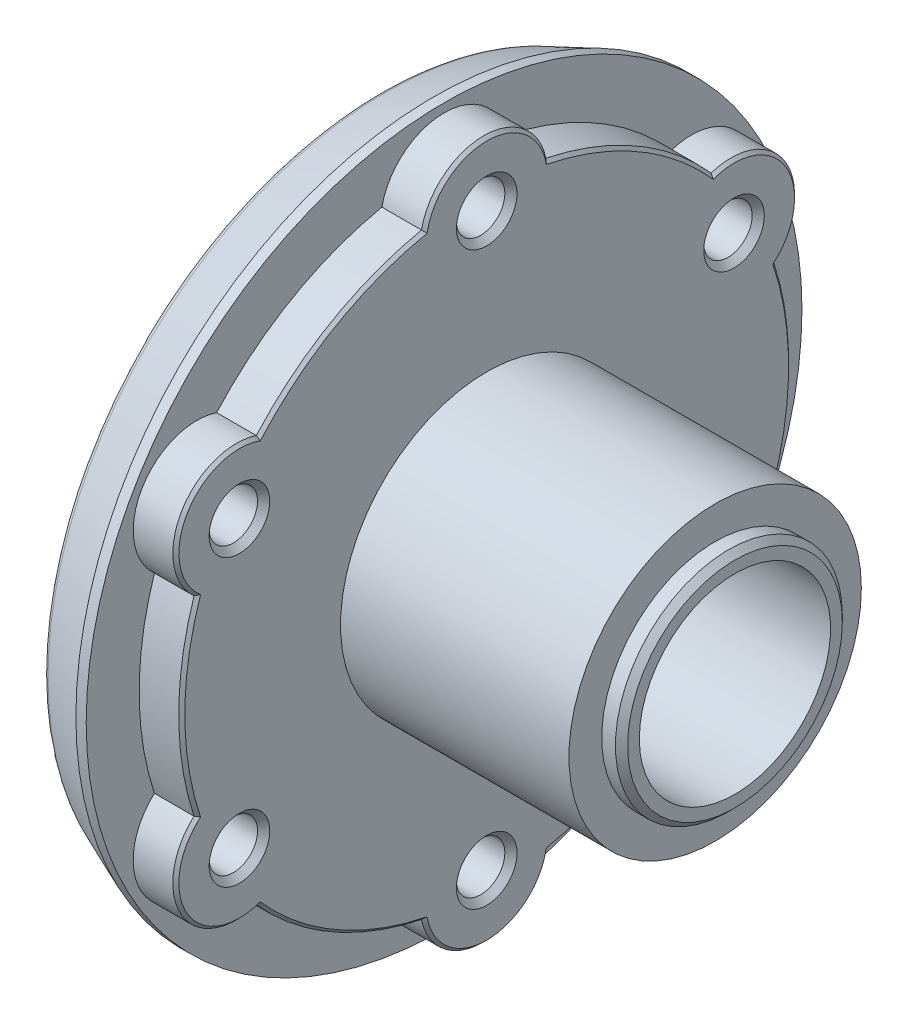
from build123d import *
from build123d.topology import SkipClean

# Parameters (mm, degrees)
SKETCH2_R                    = 12.7635
BOSS_EXTRUDE1_DEPTH          = 19.05
SKETCH3_R                    = 9.4615
BOSS_EXTRUDE2_DEPTH          = 1.651
F_5_8_0_628_DIAMETER_HOLE1_D = 15.9512
F_21_0_159_DIAMETER_HOLE1_D  = 4.0386
F_21_0_159_DIAMETER_HOLE2_D  = 4.0386
CHAMFER1_SIZE                = 0.508000007
FILLET1_R                    = 1.016
FILLET2_R                    = 2.54
SKETCH10_R                   = 29.845
CUT_EXTRUDE1_DEPTH           = 3.556
CHAMFER3_SIZE                = 0.254
SKETCH12_R                   = 33.252215347
SKETCH12_R_2                 = 12.192
OUTSIDE_BORE_TRIM_DEPTH      = 20.701
SKETCH15_R                   = 16.7132
SKETCH15_R_2                 = 7.9756
BOSS_EXTRUDE5_DEPTH          = 6.35
CHAMFER6_SIZE                = 0.508


with BuildPart() as part:
    # Sketch1 → Revolve1 (revolve)
    with BuildSketch(Plane(origin=(0, 0, 0), x_dir=(-1, 0, 0), z_dir=(0, 0, -1)), mode=Mode.PRIVATE) as revolve1_sk:
        Polygon((-55.88, 29.845), (-55.88, 0), (-46.863, 0), (-46.863, 27.94), (-51.462076836, 29.845), align=None)
    revolve(revolve1_sk.sketch.rotate(Axis((55.88, 0, 0), (-1, 0, 0)), 270), axis=Axis((55.88, 0, 0), (-1, 0, 0)))

    # Sketch2 → Boss-Extrude1 (add)
    with BuildSketch(Plane(origin=(55.88, 0, 0), x_dir=(0, 0, -1), z_dir=(1, 0, 0))):
        with Locations(Location((0, 0, 0), (0, 0, 180))):
            Circle(SKETCH2_R)
    extrude(amount=BOSS_EXTRUDE1_DEPTH)

    # Sketch3 → Boss-Extrude2 (add)
    with BuildSketch(Plane(origin=(74.93, 0, 0), x_dir=(0, 0, -1), z_dir=(1, 0, 0))):
        Circle(SKETCH3_R)
    extrude(amount=BOSS_EXTRUDE2_DEPTH)

    # 5/8 (0.628) Diameter Hole1 (through all)
    with Locations(Plane.ZY.offset(-46.863)):
        with Locations((0, 0)):
            Hole(F_5_8_0_628_DIAMETER_HOLE1_D / 2)

    # #21 (0.159) Diameter Hole1 (through all)
    with Locations(Plane(origin=(55.88, 0, 0), x_dir=(0, 0, -1), z_dir=(1, 0, 0))):
        with Locations((-20.622229928, 11.90625), (20.622229928, 11.90625), (20.622229928, -11.90625), (0, -23.8125)):
            Hole(F_21_0_159_DIAMETER_HOLE1_D / 2)

    # #21 (0.159) Diameter Hole2 (through all)
    with Locations(Plane.ZY.offset(-46.863)):
        with Locations((20.622229928, -11.90625), (0, 23.8125)):
            Hole(F_21_0_159_DIAMETER_HOLE2_D / 2)

    # Chamfer1
    chamfer1_edges = [part.edges().sort_by_distance(p)[0] for p in [
        (74.93, 0, -12.7635),
        (76.581, 0, 9.4615),
        (55.88, -23.8125, -2.0193),
        (46.863, -23.8125, -2.0193),
        (55.88, -11.90625, -22.641529928),
        (46.863, -11.90625, -22.641529928),
        (55.88, 11.90625, -22.641529928),
        (46.863, 11.90625, -22.641529928),
        (55.88, 11.90625, 18.602929928),
        (46.863, 11.90625, 18.602929928),
        (55.88, 23.8125, 2.0193),
        (46.863, 23.8125, 2.0193),
        (55.88, -11.90625, 22.641529928),
        (46.863, -11.90625, 22.641529928),
    ]]
    chamfer(chamfer1_edges, length=CHAMFER1_SIZE)

    # Fillet1
    fillet1_edges = [part.edges().sort_by_distance(p)[0] for p in [
        (46.863, 0, -27.94),
    ]]
    fillet(fillet1_edges, radius=FILLET1_R)

    # Fillet2
    fillet2_edges = [part.edges().sort_by_distance(p)[0] for p in [
        (55.88, 0, -12.7635),
    ]]
    fillet(fillet2_edges, radius=FILLET2_R)

    # Sketch10 → Cut-Extrude1 (cut)
    with BuildSketch(Plane(origin=(55.88, 0, 0), x_dir=(0, 0, -1), z_dir=(1, 0, 0))):
        with Locations(Location((0, 0, 0), (0, 0, 180))):
            Circle(SKETCH10_R)
        with BuildLine():
            ThreePointArc((5.194684655, 24.894464178), (12.71872072, 22.021653827), (18.96710386, 16.940131795))
            ThreePointArc((18.96710386, 16.940131795), (25.217002518, 14.554101773), (24.156474078, 7.94882722))
            ThreePointArc((24.156474078, 7.94882722), (25.430672133, -0.003203872), (24.154470478, -7.954913657))
            ThreePointArc((24.154470478, -7.954913657), (25.213334557, -14.560455175), (18.962834963, -16.944910398))
            ThreePointArc((18.962834963, -16.944910398), (12.713171601, -22.024857913), (5.188411857, -24.895772345))
            ThreePointArc((5.188411857, -24.895772345), (-0.002445392, -29.114749939), (-5.19259389, -24.894900477))
            ThreePointArc((-5.19259389, -24.894900477), (-12.717500776, -22.022358557), (-18.966649715, -16.940640514))
            ThreePointArc((-18.966649715, -16.940640514), (-25.214891362, -14.55429486), (-24.156019778, -7.950208229))
            ThreePointArc((-24.156019778, -7.950208229), (-25.430672245, 0.003203856), (-24.154015788, 7.956294514))
            ThreePointArc((-24.154015788, 7.956294514), (-25.21122333, 14.560647771), (-18.962380547, 16.945418955))
            ThreePointArc((-18.962380547, 16.945418955), (-12.711951385, 22.02556217), (-5.186321013, 24.896207969))
            ThreePointArc((-5.186321013, 24.896207969), (0.004890594, 29.114749631), (5.194684655, 24.894464178))
        make_face(mode=Mode.SUBTRACT)
    extrude(amount=-CUT_EXTRUDE1_DEPTH, mode=Mode.SUBTRACT)

    # Chamfer3
    chamfer3_edges = [part.edges().sort_by_distance(p)[0] for p in [
        (55.88, 14.554101773, -25.217002518),
        (55.88, 22.021653827, -12.71872072),
        (55.88, 29.114749631, -0.004890594),
        (55.88, 22.02556217, 12.711951385),
        (55.88, 14.560647771, 25.21122333),
        (55.88, 0.003203856, 25.430672245),
        (55.88, -14.55429486, 25.214891362),
        (55.88, -22.022358557, 12.717500776),
        (55.88, -29.114749939, 0.002445392),
        (55.88, -22.024857913, -12.713171601),
        (55.88, -14.560455175, -25.213334557),
        (55.88, -0.003203872, -25.430672133),
    ]]
    chamfer(chamfer3_edges, length=CHAMFER3_SIZE)

    # Sketch12 → Outside Bore Trim (cut)
    with BuildSketch(Plane(origin=(76.581, 0, 0), x_dir=(0, 0, -1), z_dir=(1, 0, 0))):
        Circle(SKETCH12_R)
        Circle(SKETCH12_R_2, mode=Mode.SUBTRACT)
    extrude(amount=-OUTSIDE_BORE_TRIM_DEPTH, mode=Mode.SUBTRACT)

    # Sketch15 → Boss-Extrude5 (add)
    with SkipClean():  # the faces are left unmerged after this step: merging them gives an invalid solid
        with BuildSketch(Plane.ZY.offset(-46.863)):
            Circle(SKETCH15_R)
            Circle(SKETCH15_R_2, mode=Mode.SUBTRACT)
        extrude(amount=BOSS_EXTRUDE5_DEPTH)
    add(part.part.scale(1), mode=Mode.REPLACE)  # the faces are merged on a copy

    # Chamfer6
    chamfer6_edges = [part.edges().sort_by_distance(p)[0] for p in [
        (40.513, 0, -16.7132),
        (40.513, 0, -7.9756),
    ]]
    chamfer(chamfer6_edges, length=CHAMFER6_SIZE)


solid = part.part
